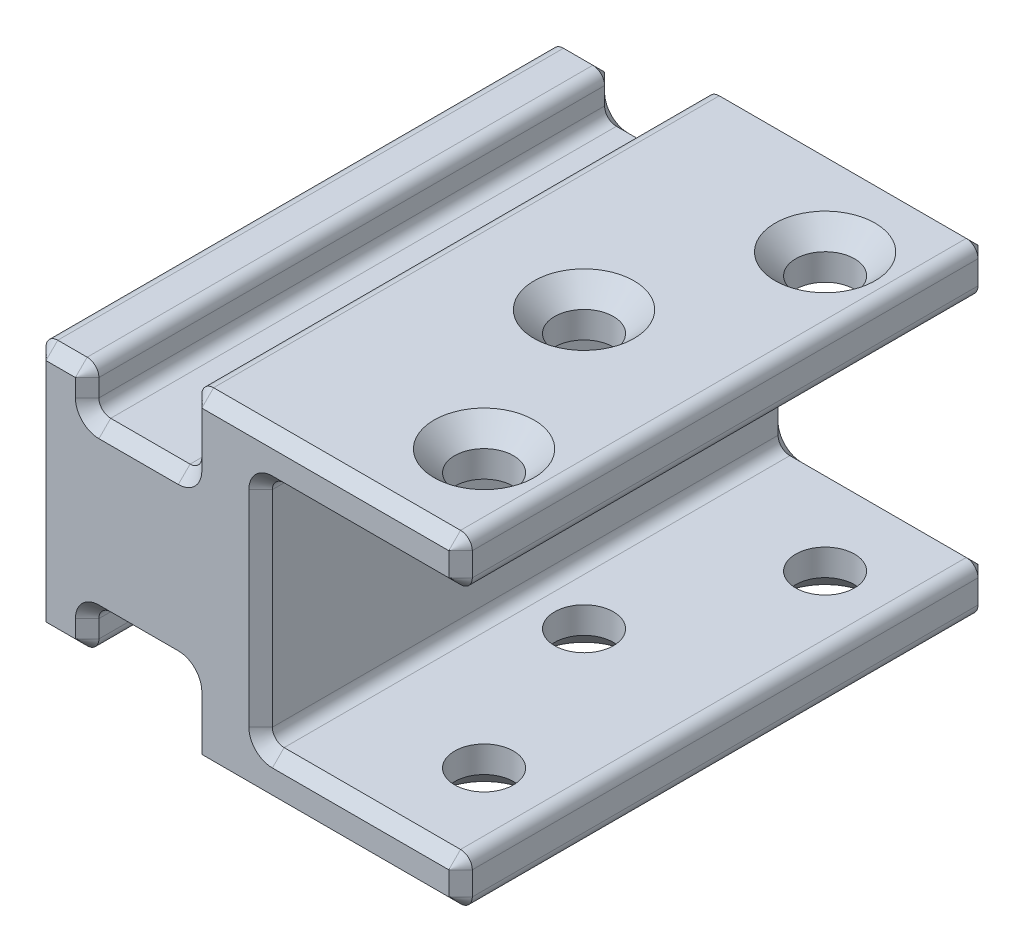
from build123d import *

# Parameters (mm, degrees)
BOSS_EXTRUDE1_DEPTH = 22.5
SKETCH2_R           = 2.5
CUT_EXTRUDE1_DEPTH  = 51.759851261
CHAMFER1_SIZE       = 1.75
FILLET1_R           = 1
CHAMFER2_SIZE       = 1


with BuildPart() as part:
    # Sketch1 → Boss-Extrude1 (new, symmetric)
    with BuildSketch(Plane.XY):
        Polygon((0, -10.625), (0, 10.625), (4.5, 10.625), (4.5, 7.125), (13.25, 7.125), (13.25, 13.75), (36.25, 13.75), (36.25, 9.75), (19.25, 9.75), (19.25, -9.75), (36.25, -9.75), (36.25, -13.75), (13.25, -13.75), (13.25, -7.125), (4.5, -7.125), (4.5, -10.625), align=None)
    extrude(amount=BOSS_EXTRUDE1_DEPTH, both=True)

    # Sketch2 → Cut-Extrude1 (cut, through all)
    with BuildSketch(Plane.XZ.offset(13.75)):
        with Locations((30.25, 14.5)):
            Circle(SKETCH2_R)
        with Locations((24.25, 0)):
            Circle(SKETCH2_R)
        with Locations((30.25, -14.5)):
            Circle(SKETCH2_R)
    extrude(amount=-CUT_EXTRUDE1_DEPTH, mode=Mode.SUBTRACT)

    # Chamfer1
    chamfer1_edges = [part.edges().sort_by_distance(p)[0] for p in [
        (27.75, 13.75, -14.5),
        (21.75, 13.75, 0),
        (27.75, 13.75, 14.5),
        (27.75, -13.75, -14.5),
        (27.75, -13.75, 14.5),
        (21.75, -13.75, 0),
    ]]
    chamfer(chamfer1_edges, length=CHAMFER1_SIZE)

    # Fillet1
    fillet1_edges = [part.edges().sort_by_distance(p)[0] for p in [
        (4.5, 10.625, 0),
        (4.5, 7.125, 0),
        (13.25, 7.125, 0),
        (13.25, 13.75, 0),
        (36.25, 13.75, 0),
        (36.25, 9.75, 0),
        (19.25, 9.75, 0),
        (19.25, -9.75, 0),
        (36.25, -9.75, 0),
        (36.25, -13.75, 0),
        (13.25, -13.75, 0),
        (13.25, -7.125, 0),
        (4.5, -7.125, 0),
        (0, -10.625, 0),
        (0, 10.625, 0),
        (4.5, -10.625, 0),
    ]]
    fillet(fillet1_edges, radius=FILLET1_R)

    # Chamfer2
    chamfer2_edges = [part.edges().sort_by_distance(p)[0] for p in [
        (24.75, 13.75, -22.5),
        (13.542893219, 13.457106781, -22.5),
        (35.957106781, 13.457106781, -22.5),
        (13.25, 10.4375, -22.5),
        (36.25, 11.75, -22.5),
        (12.957106781, 7.417893219, -22.5),
        (35.957106781, 10.042893219, -22.5),
        (8.875, 7.125, -22.5),
        (27.75, 9.75, -22.5),
        (4.792893219, 7.417893219, -22.5),
        (19.542893219, 9.457106781, -22.5),
        (4.5, 8.875, -22.5),
        (19.25, 0, -22.5),
        (4.207106781, 10.332106781, -22.5),
        (19.542893219, -9.457106781, -22.5),
        (2.25, 10.625, -22.5),
        (27.75, -9.75, -22.5),
        (0.292893219, 10.332106781, -22.5),
        (35.957106781, -10.042893219, -22.5),
        (0, 0, -22.5),
        (36.25, -11.75, -22.5),
        (0.292893219, -10.332106781, -22.5),
        (35.957106781, -13.457106781, -22.5),
        (2.25, -10.625, -22.5),
        (24.75, -13.75, -22.5),
        (4.207106781, -10.332106781, -22.5),
        (13.542893219, -13.457106781, -22.5),
        (4.5, -8.875, -22.5),
        (13.25, -10.4375, -22.5),
        (4.792893219, -7.417893219, -22.5),
        (12.957106781, -7.417893219, -22.5),
        (8.875, -7.125, -22.5),
        (24.75, 13.75, 22.5),
        (13.542893219, 13.457106781, 22.5),
        (35.957106781, 13.457106781, 22.5),
        (13.25, 10.4375, 22.5),
        (36.25, 11.75, 22.5),
        (12.957106781, 7.417893219, 22.5),
        (35.957106781, 10.042893219, 22.5),
        (8.875, 7.125, 22.5),
        (27.75, 9.75, 22.5),
        (4.792893219, 7.417893219, 22.5),
        (19.542893219, 9.457106781, 22.5),
        (4.5, 8.875, 22.5),
        (19.25, 0, 22.5),
        (4.207106781, 10.332106781, 22.5),
        (19.542893219, -9.457106781, 22.5),
        (2.25, 10.625, 22.5),
        (27.75, -9.75, 22.5),
        (0.292893219, 10.332106781, 22.5),
        (35.957106781, -10.042893219, 22.5),
        (0, 0, 22.5),
        (36.25, -11.75, 22.5),
        (0.292893219, -10.332106781, 22.5),
        (35.957106781, -13.457106781, 22.5),
        (2.25, -10.625, 22.5),
        (24.75, -13.75, 22.5),
        (4.207106781, -10.332106781, 22.5),
        (13.542893219, -13.457106781, 22.5),
        (4.5, -8.875, 22.5),
        (13.25, -10.4375, 22.5),
        (4.792893219, -7.417893219, 22.5),
        (12.957106781, -7.417893219, 22.5),
        (8.875, -7.125, 22.5),
    ]]
    chamfer(chamfer2_edges, length=CHAMFER2_SIZE)


solid = part.part
